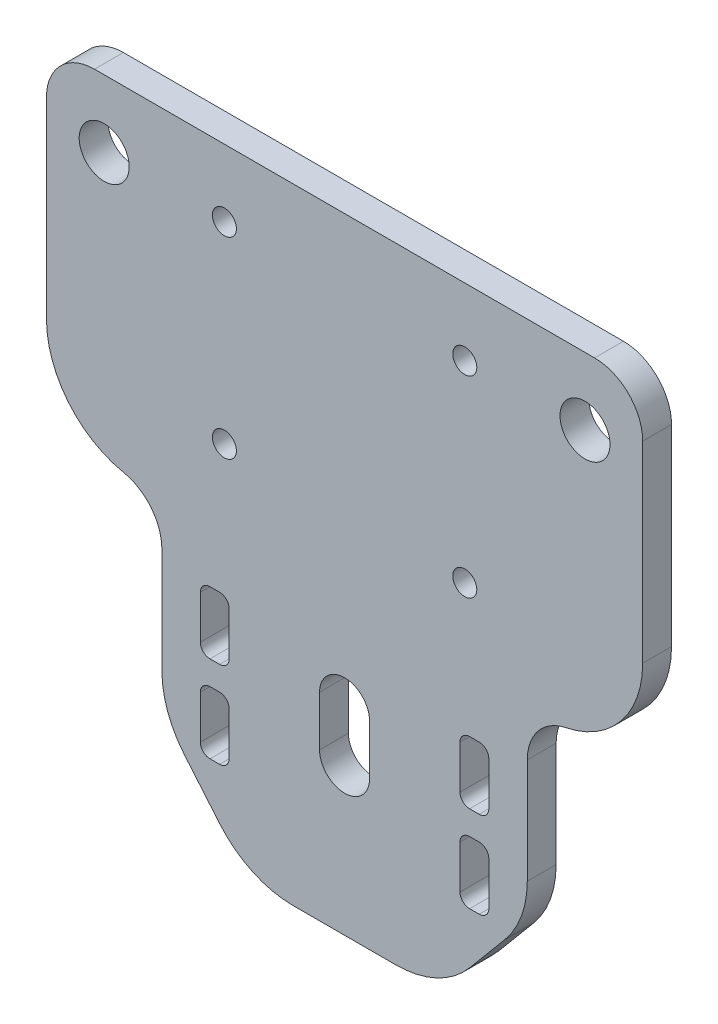
from build123d import *

# Parameters (mm, degrees)
SKETCH1_R            = 2.6
SKETCH1_R_2          = 1.25
BASE_FLANGE1_DEPTH   = 3
FILLET1_R            = 5
FILLET2_R            = 10
CUT_EXTRUDE1_REACH   = 74.507
SKETCH3_W            = 3
SKETCH3_H            = 6.5
FILLET3_R            = 1
FILLET3_OF_MIRROR1_R = 1
FILLET4_R            = 5


# Sheet-metal steps are written as plain solids
with BuildPart() as part:
    # Sketch1 → Base-Flange1 (new body)
    with BuildSketch(Plane.XY):
        Polygon((-31, -0.476720525), (31, -0.476720525), (31, -35.476720525), (19, -35.476720525), (19, -54.752062511), (10, -65.476720525), (-10, -65.476720525), (-19, -54.752062511), (-19, -35.476720525), (-31, -35.476720525), align=None)
        with Locations((25, -7.476720525)):
            Circle(SKETCH1_R, mode=Mode.SUBTRACT)
        with Locations((-25, -7.476720525)):
            Circle(SKETCH1_R, mode=Mode.SUBTRACT)
        with Locations((-12.5, -27.476720525)):
            Circle(SKETCH1_R_2, mode=Mode.SUBTRACT)
        with Locations((12.5, -27.476720525)):
            Circle(SKETCH1_R_2, mode=Mode.SUBTRACT)
        with Locations((12.5, -7.476720525)):
            Circle(SKETCH1_R_2, mode=Mode.SUBTRACT)
        with Locations((-12.5, -7.476720525)):
            Circle(SKETCH1_R_2, mode=Mode.SUBTRACT)
        with BuildLine():
            Line((-2.6, -50.076720525), (-2.6, -44.876720525))
            ThreePointArc((-2.6, -44.876720525), (0, -42.276720525), (2.6, -44.876720525))
            Line((2.6, -44.876720525), (2.6, -50.076720525))
            ThreePointArc((2.6, -50.076720525), (0, -52.676720525), (-2.6, -50.076720525))
        make_face(mode=Mode.SUBTRACT)
    extrude(amount=-BASE_FLANGE1_DEPTH)

    # Fillet1
    fillet1_edges = [part.edges().sort_by_distance(p)[0] for p in [
        (-31, -0.476720525, -1.5),
        (31, -0.476720525, -1.5),
    ]]
    fillet(fillet1_edges, radius=FILLET1_R)

    # Fillet2
    fillet2_edges = [part.edges().sort_by_distance(p)[0] for p in [
        (31, -35.476720525, -1.5),
        (19, -54.752062511, -1.5),
        (10, -65.476720525, -1.5),
        (-10, -65.476720525, -1.5),
        (-19, -54.752062511, -1.5),
        (-31, -35.476720525, -1.5),
    ]]
    fillet(fillet2_edges, radius=FILLET2_R)

    # Sketch3 → Cut-Extrude1 (cut, up to next)
    with BuildSketch(Plane.XY, mode=Mode.PRIVATE) as cut_extrude1_sk1:
        with Locations((13.5, -44.326720525)):
            Rectangle(SKETCH3_W, SKETCH3_H)
    cut_extrude1_tool1 = extrude(cut_extrude1_sk1.sketch, amount=-CUT_EXTRUDE1_REACH, mode=Mode.PRIVATE) & part.part
    # Sketch3 → Cut-Extrude1 (cut, up to next)
    with BuildSketch(Plane.XY, mode=Mode.PRIVATE) as cut_extrude1_sk2:
        with Locations((13.5, -53.326720525)):
            Rectangle(SKETCH3_W, SKETCH3_H)
    cut_extrude1_tool2 = extrude(cut_extrude1_sk2.sketch, amount=-CUT_EXTRUDE1_REACH, mode=Mode.PRIVATE) & part.part
    cut_extrude1_1 = cut_extrude1_tool1.solids().sort_by_distance((13.5, -44.326721, 0))[0]
    add(cut_extrude1_1, mode=Mode.SUBTRACT)
    cut_extrude1_2 = cut_extrude1_tool2.solids().sort_by_distance((13.5, -53.326721, 0))[0]
    add(cut_extrude1_2, mode=Mode.SUBTRACT)
    cut_extrude1 = cut_extrude1_1 + cut_extrude1_2  # Cut-Extrude1 as one shape, for the pattern or mirror that repeats it

    # Fillet3
    fillet3_edges = [part.edges().sort_by_distance(p)[0] for p in [
        (12, -47.576720525, -1.5),
        (12, -41.076720525, -1.5),
        (15, -41.076720525, -1.5),
        (15, -47.576720525, -1.5),
        (12, -56.576720525, -1.5),
        (12, -50.076720525, -1.5),
        (15, -50.076720525, -1.5),
        (15, -56.576720525, -1.5),
    ]]
    fillet(fillet3_edges, radius=FILLET3_R)

    # Mirror1: Cut-Extrude1 across plane
    add(cut_extrude1.mirror(Plane(origin=(0, 0, 0), x_dir=(0, 0, 1), z_dir=(1, 0, 0))), mode=Mode.SUBTRACT)

    # Fillet3 of Mirror1
    fillet3_of_mirror1_edges = [part.edges().sort_by_distance(p)[0] for p in [
        (-12, -47.576720525, -1.5),
        (-12, -41.076720525, -1.5),
        (-15, -41.076720525, -1.5),
        (-15, -47.576720525, -1.5),
        (-12, -56.576720525, -1.5),
        (-12, -50.076720525, -1.5),
        (-15, -50.076720525, -1.5),
        (-15, -56.576720525, -1.5),
    ]]
    fillet(fillet3_of_mirror1_edges, radius=FILLET3_OF_MIRROR1_R)

    # Fillet4
    fillet4_edges = [part.edges().sort_by_distance(p)[0] for p in [
        (19, -35.476720525, -1.5),
        (-19, -35.476720525, -1.5),
    ]]
    fillet(fillet4_edges, radius=FILLET4_R)


solid = part.part
